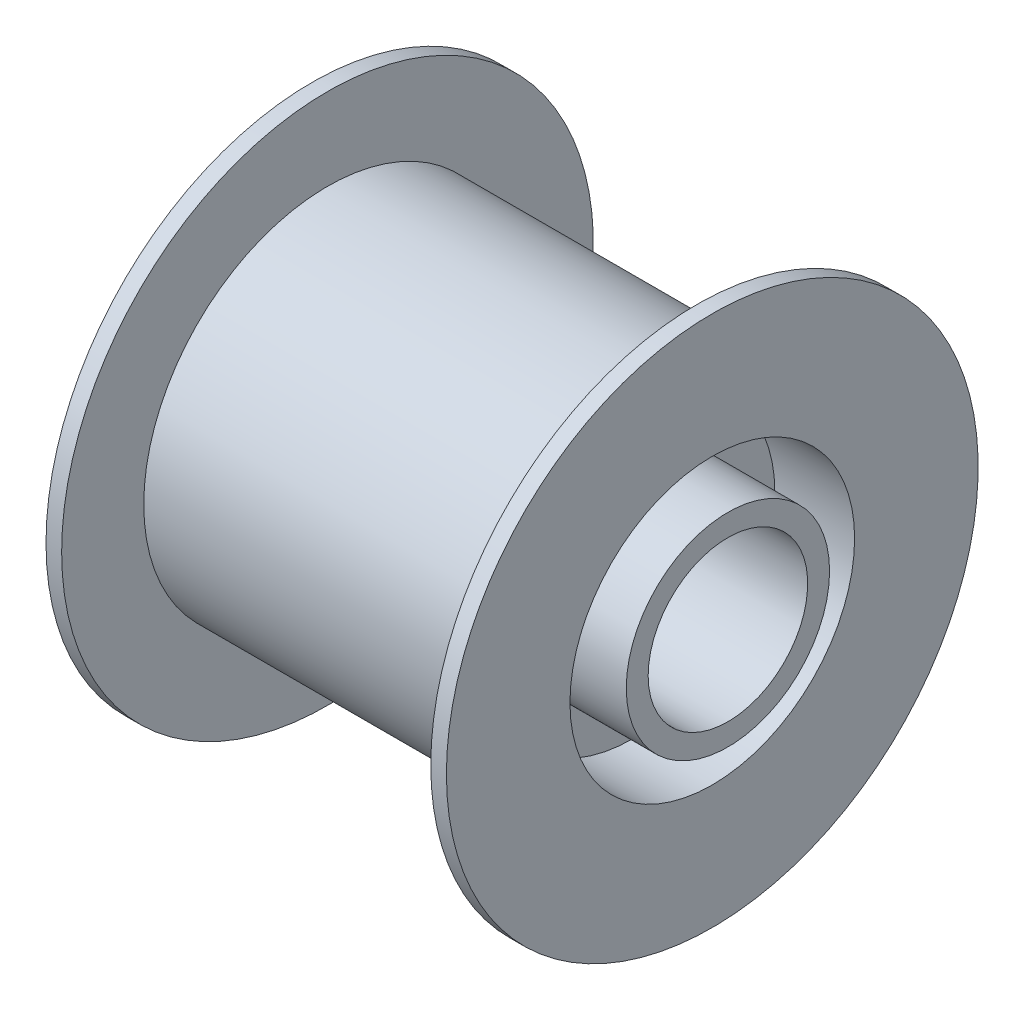
from build123d import *


with BuildPart() as part:
    # Sketch1 → Revolve1 (revolve)
    with BuildSketch(Plane.XY):
        Polygon((0, 6.5), (0, 5.1), (27.6, 5.1), (27.6, 6.5), (21.5, 6.5), (21.5, 9.1), (26.6, 9.1), (26.6, 17), (25.6, 17), (25.6, 11.75), (2, 11.75), (2, 17), (1, 17), (1, 9.1), (6.1, 9.1), (6.1, 6.5), align=None)
    revolve(axis=Axis((0, 0, 0), (1, 0, 0)))


solid = part.part
